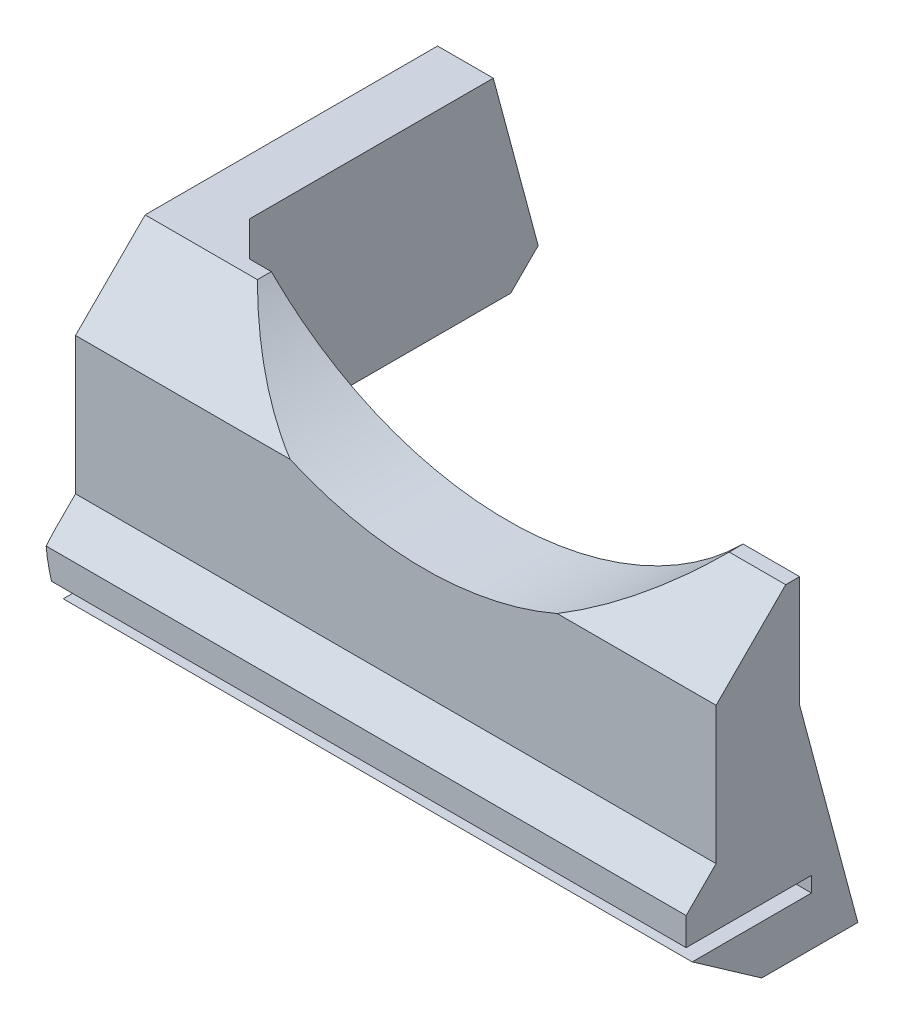
from build123d import *
from OCP.BRepFilletAPI import BRepFilletAPI_MakeChamfer

# Parameters (mm, degrees)
BOSS_EXTRUDE1_DEPTH  = 21
BOSS_EXTRUDE4_DEPTH  = 6
CHAMFER4_SIZE        = 5
BOSS_EXTRUDE5_DEPTH  = 4
BOSS_EXTRUDE10_DEPTH = 4
FILLET1_R            = 10
CHAMFER5_SIZE        = 2.5
CHAMFER5_SIZE2       = 2.041241452


with BuildPart() as part:
    # Sketch1 → Boss-Extrude1 (new, symmetric)
    with BuildSketch(Plane(origin=(0, 0, 0), x_dir=(0, 0, -1), z_dir=(1, 0, 0))):
        Polygon((0, -6), (4, -6), (-0.849880383, 12.1), (-6.849880383, 12.1), (-6.849880383, 5.250119617), (-9, 3.1), (-9, 1.1), (0, 1.1), (0, 0), (-8.56888804, 0), align=None)
    extrude(amount=BOSS_EXTRUDE1_DEPTH, both=True)

    # Sketch7 → Boss-Extrude4 (add)
    with BuildSketch(Plane.XY.offset(6.849880383)):
        with BuildLine():
            Line((-21, 12.1), (-21, 20.1))
            Line((-21, 20.1), (-16.941074346, 20.1))
            ThreePointArc((-16.941074346, 20.1), (0, 13.1), (16.941074346, 20.1))
            Line((16.941074346, 20.1), (21, 20.1))
            Line((21, 20.1), (21, 12.1))
            Line((21, 12.1), (-21, 12.1))
        make_face()
    extrude(amount=-BOSS_EXTRUDE4_DEPTH)

    # Chamfer4
    chamfer4_edges = [part.edges().sort_by_distance(p)[0] for p in [
        (-18.970537173, 20.1, 6.849880383),
        (18.970537173, 20.1, 6.849880383),
    ]]
    chamfer(chamfer4_edges, length=CHAMFER4_SIZE)

    # Sketch15 → Boss-Extrude5 (add)
    with BuildSketch(Plane.ZY.offset(21)):
        Polygon((9, 1.1), (9, 3.1), (6.849880383, 5.250119617), (6.849880383, 15.1), (1.849880383, 20.1), (0.849880383, 20.1), (0.849880383, 12.1), (-4, -6), (0, -6), (8.56888804, 0), (0, 0), (0, 1.1), align=None)
    extrude(amount=BOSS_EXTRUDE5_DEPTH)

    # Sketch22 → Boss-Extrude10 (add)
    with BuildSketch(Plane.ZY.offset(25)):
        Polygon((0.849880383, 6.1), (0.849880383, 1.1), (-4.150119617, 6.1), (-19.150119617, 6.1), (-22.901408311, 6.1), (-19.150119617, 20.1), (0.849880383, 20.1), align=None)
    extrude(amount=-BOSS_EXTRUDE10_DEPTH)

    # Fillet1
    # the kernel refuses this fillet: 10 mm, written as the material it takes off along each edge
    with BuildSketch(Plane(origin=(-25, -6, -29), x_dir=(1, 0, 0), z_dir=(0, 0, 1))) as fillet1_piece_1:
        with BuildLine():
            CenterArc((FILLET1_R, FILLET1_R), FILLET1_R, 180, 90)
            Line((0, FILLET1_R), (0, 0))
            Line((0, 0), (FILLET1_R, 0))
        make_face()
    extrude(amount=54, mode=Mode.SUBTRACT)

    # Chamfer5: one chamfer whose edges measure the first distance from different faces: ONE call of the kernel's chamfer builder (chamfer() names one face for all edges)
    chamfer5_edges_1 = [part.edges().sort_by_distance(p)[0] for p in [
        (21, -6, -2),
        (-21, 16.1, 0.849880383),
    ]]
    chamfer5_edges_2 = [part.edges().sort_by_distance(p)[0] for p in [
        (-23, 6.1, -22.901408311),
    ]]
    chamfer5_side_2 = [part.faces().sort_by_distance(p)[0] for p in [
        (-23, 6.1, -13.525763964),
    ]]
    chamfer5 = BRepFilletAPI_MakeChamfer(part.part.solid().wrapped)
    for e in chamfer5_edges_1:
        chamfer5.Add(CHAMFER5_SIZE, e.wrapped)
    for e in chamfer5_edges_2:
        chamfer5.Add(CHAMFER5_SIZE, CHAMFER5_SIZE2, e.wrapped, chamfer5_side_2[0].wrapped)  # the first distance lies on this face
    add(Compound.cast(chamfer5.Shape()), mode=Mode.REPLACE)


solid = part.part
